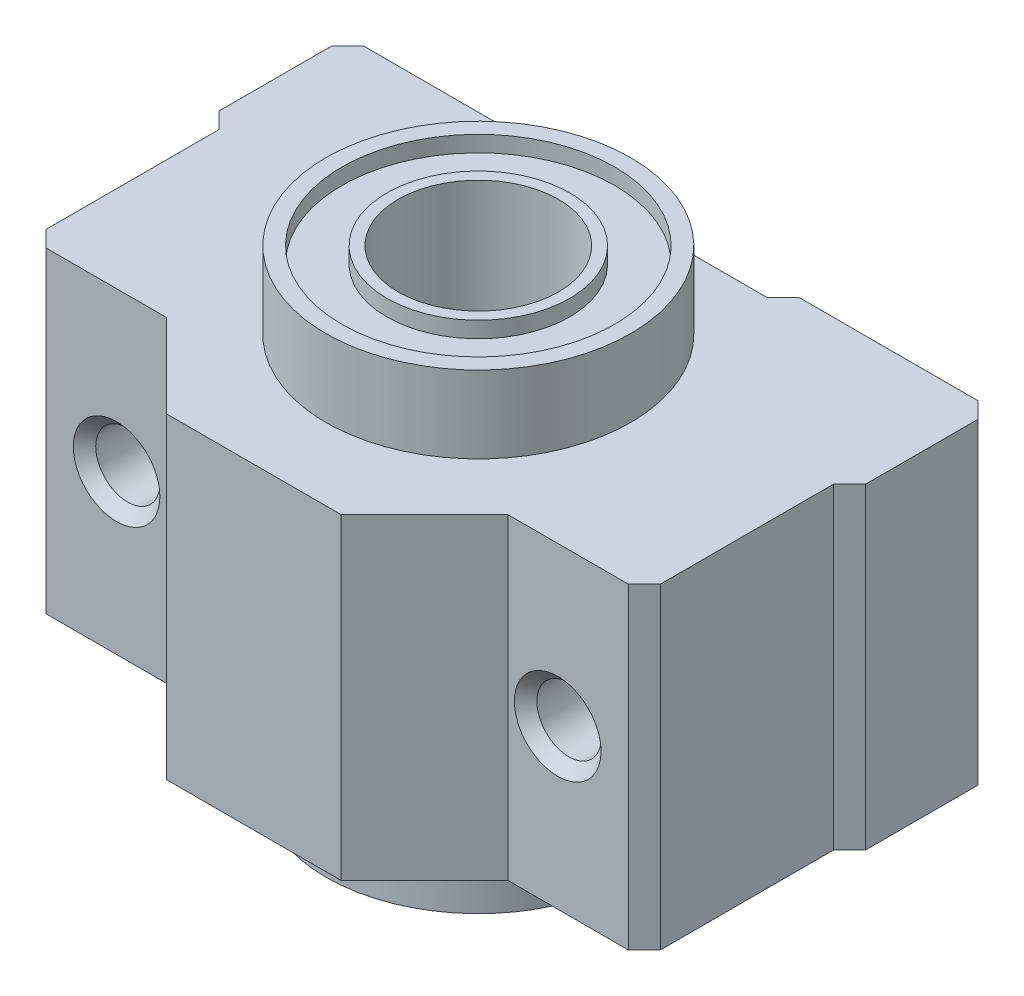
from build123d import *

# Parameters (mm, degrees)
CROQUIS1_W              = 40.3
CROQUIS1_H              = 19.75
SALIENTE_EXTRUIR1_DEPTH = 26
CROQUIS2_W              = 14
CROQUIS2_H              = 1
CORTAR_EXTRUIR1_DEPTH   = 20
CROQUIS3_R              = 2
CORTAR_EXTRUIR2_DEPTH   = 26
CROQUIS4_R              = 9.5
SALIENTE_EXTRUIR2_DEPTH = 4.8
CROQUIS5_R              = 5
CORTAR_EXTRUIR3_DEPTH   = 30
CROQUIS6_R              = 8.5
CROQUIS6_R_2            = 5.7
CORTAR_EXTRUIR4_DEPTH   = 1
CHAFL_N1_SIZE           = 1
CHAFL_N2_SIZE           = 0.7


with BuildPart() as part:
    # Croquis1 → Saliente-Extruir1 (new body)
    with BuildSketch(Plane.XY):
        Rectangle(CROQUIS1_W, CROQUIS1_H)
    extrude(amount=SALIENTE_EXTRUIR1_DEPTH)

    # Croquis2 → Cortar-Extruir1 (cut)
    with BuildSketch(Plane(origin=(0, 9.875, 0), x_dir=(1, 0, 0), z_dir=(0, 1, 0))):
        Polygon((-19.15, -9), (-20.15, -9), (-20.15, -26), (-5.45, -26), (-10.65, -20.8), (-19.15, -20.8), align=None)
        Polygon((20.15, -26), (20.15, -9), (19.15, -9), (19.15, -20.8), (10.65, -20.8), (5.45, -26), align=None)
        with Locations((0, -0.5)):
            Rectangle(CROQUIS2_W, CROQUIS2_H)
    extrude(amount=-CORTAR_EXTRUIR1_DEPTH, mode=Mode.SUBTRACT)

    # Croquis3 → Cortar-Extruir2 (cut)
    with BuildSketch(Plane(origin=(0, 0, 0), x_dir=(-1, 0, 0), z_dir=(0, 0, -1))):
        with Locations((-13.75, 0)):
            Circle(CROQUIS3_R)
        with Locations((13.75, 0)):
            Circle(CROQUIS3_R)
    extrude(amount=-CORTAR_EXTRUIR2_DEPTH, mode=Mode.SUBTRACT)

    # Croquis4 → Saliente-Extruir2 (add)
    with BuildSketch(Plane.XZ.offset(9.875)):
        with Locations(Location((0, 12, 0), (0, 0, 90))):
            Circle(CROQUIS4_R)
    saliente_extruir2 = extrude(amount=SALIENTE_EXTRUIR2_DEPTH)

    # Simetría1: Saliente-Extruir2 across plane
    add(saliente_extruir2.mirror(Plane.ZX))

    # Croquis5 → Cortar-Extruir3 (cut)
    with BuildSketch(Plane.XZ.offset(14.675)):
        with Locations(Location((0, 12, 0), (0, 0, 270))):
            Circle(CROQUIS5_R)
    extrude(amount=-CORTAR_EXTRUIR3_DEPTH, mode=Mode.SUBTRACT)

    # Croquis6 → Cortar-Extruir4 (cut)
    with BuildSketch(Plane(origin=(0, 14.675, 0), x_dir=(1, 0, 0), z_dir=(0, 1, 0))):
        with Locations(Location((0, -12, 0), (0, 0, 270))):
            Circle(CROQUIS6_R)
        with Locations(Location((0, -12, 0), (0, 0, 270))):
            Circle(CROQUIS6_R_2, mode=Mode.SUBTRACT)
    cortar_extruir4 = extrude(amount=-CORTAR_EXTRUIR4_DEPTH, mode=Mode.SUBTRACT)

    # Simetría2: Cortar-Extruir4 across plane
    add(cortar_extruir4.mirror(Plane.ZX), mode=Mode.SUBTRACT)

    # Chaflán1
    chafl_n1_edges = [part.edges().sort_by_distance(p)[0] for p in [
        (-19.15, 0, 20.8),
        (-20.15, 0, 9),
        (19.15, 0, 20.8),
        (20.15, 0, 9),
        (-20.15, 0, 0),
        (20.15, 0, 0),
        (7, 0, 0),
        (-7, 0, 0),
    ]]
    chamfer(chafl_n1_edges, length=CHAFL_N1_SIZE - 0.0001)  # a hair under: the kernel refuses the full size

    # Chaflán2
    chafl_n2_edges = [part.edges().sort_by_distance(p)[0] for p in [
        (15.75, 0, 20.8),
        (15.75, 0, 0),
        (-11.75, 0, 20.8),
        (-11.75, 0, 0),
    ]]
    chamfer(chafl_n2_edges, length=CHAFL_N2_SIZE)


solid = part.part
